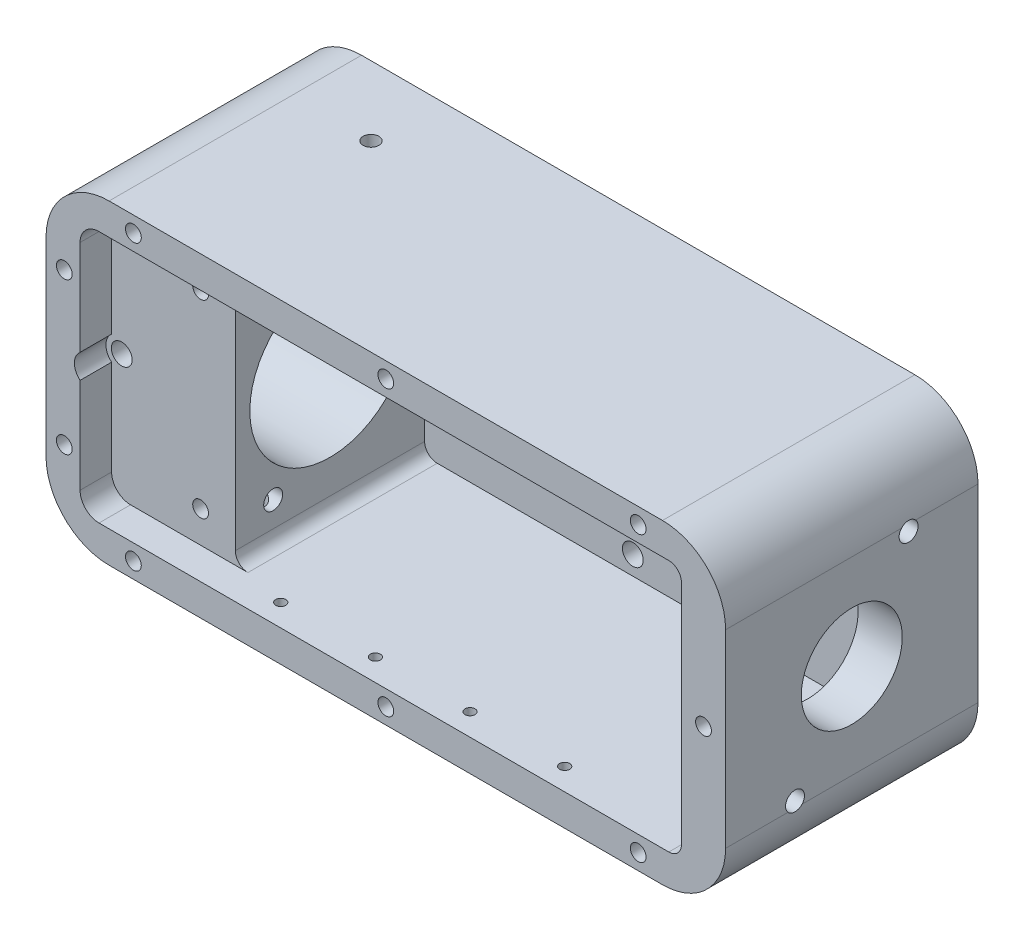
from build123d import *

# Parameters (mm, degrees)
SKETCH1_W                  = 107.7
SKETCH1_H                  = 50
BOSS_EXTRUDE1_DEPTH        = 40
SKETCH2_W                  = 75.7
SKETCH2_H                  = 40
CUT_EXTRUDE1_DEPTH         = 35
CUT_EXTRUDE2_REACH         = 125.791
SKETCH4_W                  = 19.6
SKETCH4_H                  = 40
SKETCH5_W                  = 45
SKETCH5_H                  = 10.3
CUT_EXTRUDE3_DEPTH         = 126.296807621
M4X0_7_TAPPED_HOLE1_D      = 3.3
F_3_0MM_DOWEL_HOLE1_D      = 3
F_3_0MM_DOWEL_HOLE1_DEPTH  = 7
F_3_0MM_DOWEL_HOLE2_D      = 3
F_3_0MM_DOWEL_HOLE2_DEPTH  = 7
M3X0_5_TAPPED_HOLE1_D      = 2.5
M3X0_5_TAPPED_HOLE1_DEPTH  = 7.5
M3X0_5_TAPPED_HOLE1_TIP    = 0.751075774
F_3_0MM_DOWEL_HOLE3_D      = 3
HOLE1_D                    = 16
HOLE1_DEPTH                = 7
M3X0_5_TAPPED_HOLE2_D      = 2.5
M3X0_5_TAPPED_HOLE2_DEPTH  = 7.5
M3X0_5_TAPPED_HOLE2_TIP    = 0.751075774
F_3_0MM_DOWEL_HOLE4_D      = 3
M3X0_5_TAPPED_HOLE3_D      = 2.5
M3X0_5_TAPPED_HOLE3_DEPTH  = 7.5
M3X0_5_TAPPED_HOLE3_TIP    = 0.751075774
M3X0_5_TAPPED_HOLE4_REACH  = 127.297
M3X0_5_TAPPED_HOLE4_BORE_R = 1.25
F_1_1_DIAMETER_HOLE1_D     = 25.4
F_1_1_DIAMETER_HOLE1_DEPTH = 25
M4X0_7_TAPPED_HOLE2_D      = 3.3
M4X0_7_TAPPED_HOLE2_DEPTH  = 7.407641206
M3X0_5_TAPPED_HOLE5_D      = 2.5
M3X0_5_TAPPED_HOLE5_DEPTH  = 5
M3X0_5_TAPPED_HOLE5_TIP    = 0.751075774
FILLET1_R                  = 2
FILLET2_R                  = 3
FILLET3_R                  = 10
SKETCH32_R                 = 2.5
CUT_EXTRUDE4_DEPTH         = 5
M2X0_4_TAPPED_HOLE1_D      = 1.6
M2X0_4_TAPPED_HOLE1_DEPTH  = 5.2
M2X0_4_TAPPED_HOLE1_TIP    = 0.480688495


with BuildPart() as part:
    # Sketch1 → Boss-Extrude1 (new body)
    with BuildSketch(Plane.XY.offset(40)):
        with Locations((53.85, -25)):
            Rectangle(SKETCH1_W, SKETCH1_H)
    extrude(amount=-BOSS_EXTRUDE1_DEPTH)

    # Sketch2 → Cut-Extrude1 (cut)
    with BuildSketch(Plane.XY.offset(40)):
        with Locations((62.85, -25)):
            Rectangle(SKETCH2_W, SKETCH2_H)
    extrude(amount=-CUT_EXTRUDE1_DEPTH, mode=Mode.SUBTRACT)

    # Sketch4 → Cut-Extrude2 (cut, up to next)
    with BuildSketch(Plane(origin=(0, 0, 35), x_dir=(-1, 0, 0), z_dir=(0, 0, -1)), mode=Mode.PRIVATE) as cut_extrude2_sk1:
        with Locations((-15.2, -25)):
            Rectangle(SKETCH4_W, SKETCH4_H)
    cut_extrude2_tool1 = extrude(cut_extrude2_sk1.sketch, amount=-CUT_EXTRUDE2_REACH, mode=Mode.PRIVATE) & part.part
    add(cut_extrude2_tool1.solids().sort_by_distance((15.2, -25, 35))[0], mode=Mode.SUBTRACT)

    # Sketch5 → Cut-Extrude3 (cut, through all)
    with BuildSketch(Plane(origin=(0, 0, 0), x_dir=(-1, 0, 0), z_dir=(0, 0, -1))):
        with Locations((-77.2, -25)):
            Rectangle(SKETCH5_W, SKETCH5_H)
    extrude(amount=-CUT_EXTRUDE3_DEPTH, mode=Mode.SUBTRACT)

    # M4x0.7 Tapped Hole1 (through all)
    with Locations(Plane(origin=(0, 0, 0), x_dir=(-1, 0, 0), z_dir=(0, 0, -1))):
        with Locations((-58, -42), (-78, -42), (-98, -42), (-98, -8), (-58, -8), (-78, -8)):
            Hole(M4X0_7_TAPPED_HOLE1_D / 2)

    # Ø3.0mm Dowel Hole1
    with Locations(Plane.ZY.offset(-100.7)):
        with Locations((11, -11)):
            Hole(F_3_0MM_DOWEL_HOLE1_D / 2, depth=F_3_0MM_DOWEL_HOLE1_DEPTH)

    # Ø3.0mm Dowel Hole2
    with Locations(Plane(origin=(107.7, 0, 0), x_dir=(0, 0, -1), z_dir=(1, 0, 0))):
        with Locations((-29, -39)):
            Hole(F_3_0MM_DOWEL_HOLE2_D / 2, depth=F_3_0MM_DOWEL_HOLE2_DEPTH)

    # M3x0.5 Tapped Hole1
    with Locations(Plane(origin=(0, 0, 0), x_dir=(1, 0, 0), z_dir=(0, 1, 0))):
        with Locations((22.5, -11)):
            Hole(M3X0_5_TAPPED_HOLE1_D / 2, depth=M3X0_5_TAPPED_HOLE1_DEPTH)
            with Locations((0, 0, -(M3X0_5_TAPPED_HOLE1_DEPTH + M3X0_5_TAPPED_HOLE1_TIP / 2))):  # 118° drill point
                Cone(0, M3X0_5_TAPPED_HOLE1_D / 2, M3X0_5_TAPPED_HOLE1_TIP, mode=Mode.SUBTRACT)

    # Ø3.0mm Dowel Hole3 (through all)
    with Locations(Plane(origin=(25, 0, 0), x_dir=(0, 0, -1), z_dir=(1, 0, 0))):
        with Locations((-11, -11)):
            Hole(F_3_0MM_DOWEL_HOLE3_D / 2)

    # Hole1
    with Locations(Plane.ZY.offset(-100.7)):
        with Locations((20, -25)):
            Hole(HOLE1_D / 2, depth=HOLE1_DEPTH)

    # M3x0.5 Tapped Hole2
    with Locations(Plane.XY.offset(40)):
        with Locations((104.2, -25)):
            Hole(M3X0_5_TAPPED_HOLE2_D / 2, depth=M3X0_5_TAPPED_HOLE2_DEPTH)
            with Locations((0, 0, -(M3X0_5_TAPPED_HOLE2_DEPTH + M3X0_5_TAPPED_HOLE2_TIP / 2))):  # 118° drill point
                Cone(0, M3X0_5_TAPPED_HOLE2_D / 2, M3X0_5_TAPPED_HOLE2_TIP, mode=Mode.SUBTRACT)

    # Ø3.0mm Dowel Hole4 (through all)
    with Locations(Plane.ZY):
        with Locations((29, -39)):
            Hole(F_3_0MM_DOWEL_HOLE4_D / 2)

    # M3x0.5 Tapped Hole3
    with Locations(Plane.XY.offset(40)):
        with Locations((2.9, -37), (93.85, -2.5), (53.85, -2.5), (13.85, -2.5), (2.9, -13), (13.85, -47.5), (53.85, -47.5), (93.85, -47.5)):
            Hole(M3X0_5_TAPPED_HOLE3_D / 2, depth=M3X0_5_TAPPED_HOLE3_DEPTH)
            with Locations((0, 0, -(M3X0_5_TAPPED_HOLE3_DEPTH + M3X0_5_TAPPED_HOLE3_TIP / 2))):  # 118° drill point
                Cone(0, M3X0_5_TAPPED_HOLE3_D / 2, M3X0_5_TAPPED_HOLE3_TIP, mode=Mode.SUBTRACT)

    # M3x0.5 Tapped Hole4 bore → M3x0.5 Tapped Hole4 (cut, up to next)
    with BuildSketch(Plane(origin=(0, -50, 0), x_dir=(-1, 0, 0), z_dir=(0, -1, 0)), mode=Mode.PRIVATE) as m3x0_5_tapped_hole4_sk1:
        with Locations((-22.5, -29)):
            Circle(M3X0_5_TAPPED_HOLE4_BORE_R)
    m3x0_5_tapped_hole4_tool1 = extrude(m3x0_5_tapped_hole4_sk1.sketch, amount=-M3X0_5_TAPPED_HOLE4_REACH, mode=Mode.PRIVATE) & part.part
    add(m3x0_5_tapped_hole4_tool1.solids().sort_by_distance((22.5, -50, 29))[0], mode=Mode.SUBTRACT)

    # 1 (1) Diameter Hole1
    with Locations(Plane.ZY):
        with Locations((20, -25)):
            Hole(F_1_1_DIAMETER_HOLE1_D / 2, depth=F_1_1_DIAMETER_HOLE1_DEPTH)

    # M4x0.7 Tapped Hole2
    with Locations(Plane(origin=(0, 0, 32.592358794), x_dir=(-1, 0, 0), z_dir=(0, 0, -1))):
        with Locations((-7, -25)):
            Hole(M4X0_7_TAPPED_HOLE2_D / 2, depth=M4X0_7_TAPPED_HOLE2_DEPTH)

    # M3x0.5 Tapped Hole5
    with Locations(Plane.XY.offset(35)):
        with Locations((19.5, -10), (19.5, -40)):
            Hole(M3X0_5_TAPPED_HOLE5_D / 2, depth=M3X0_5_TAPPED_HOLE5_DEPTH)
            with Locations((0, 0, -(M3X0_5_TAPPED_HOLE5_DEPTH + M3X0_5_TAPPED_HOLE5_TIP / 2))):  # 118° drill point
                Cone(0, M3X0_5_TAPPED_HOLE5_D / 2, M3X0_5_TAPPED_HOLE5_TIP, mode=Mode.SUBTRACT)

    # Fillet1
    fillet1_edges = [part.edges().sort_by_distance(p)[0] for p in [
        (100.7, -45, 22.5),
        (25, -45, 20),
        (25, -5, 20),
        (100.7, -5, 22.5),
        (99.7, -30.15, 2.5),
        (99.7, -19.85, 2.5),
        (54.7, -19.85, 2.5),
        (54.7, -30.15, 2.5),
    ]]
    fillet(fillet1_edges, radius=FILLET1_R)

    # Fillet2
    fillet2_edges = [part.edges().sort_by_distance(p)[0] for p in [
        (5.4, -45, 37.5),
        (5.4, -5, 37.5),
    ]]
    fillet(fillet2_edges, radius=FILLET2_R)

    # Fillet3
    # the kernel refuses this fillet: 10 mm, written as the material it takes off along each edge
    with BuildSketch(Plane(origin=(0, 0, 65), x_dir=(0, -1, 0), z_dir=(0, 0, -1)), Plane(origin=(0, -50, 65), x_dir=(1, 0, 0), z_dir=(0, 0, -1))) as fillet3_piece_1:
        with BuildLine():
            CenterArc((FILLET3_R, -FILLET3_R), FILLET3_R, 90, 90)
            Line((0, -FILLET3_R), (0, 0))
            Line((0, 0), (FILLET3_R, 0))
        make_face()
    extrude(amount=90, mode=Mode.SUBTRACT)
    with BuildSketch(Plane(origin=(107.7, 0, 65), x_dir=(0, -1, 0), z_dir=(0, 0, -1)), Plane(origin=(107.7, -50, 65), x_dir=(-1, 0, 0), z_dir=(0, 0, -1))) as fillet3_piece_2:
        with BuildLine():
            CenterArc((FILLET3_R, FILLET3_R), FILLET3_R, 180, 90)
            Line((0, FILLET3_R), (0, 0))
            Line((0, 0), (FILLET3_R, 0))
        make_face()
    extrude(amount=90, mode=Mode.SUBTRACT)

    # Sketch32 → Cut-Extrude4 (cut)
    with BuildSketch(Plane.XY.offset(40)):
        with Locations((7, -25)):
            Circle(SKETCH32_R)
    extrude(amount=-CUT_EXTRUDE4_DEPTH, mode=Mode.SUBTRACT)

    # M2x0.4 Tapped Hole1
    with Locations(Plane(origin=(0, -45, 0), x_dir=(1, 0, 0), z_dir=(0, 1, 0))):
        with Locations((33.7, -36.5), (48.7, -36.5), (63.7, -36.5), (78.7, -36.5)):
            Hole(M2X0_4_TAPPED_HOLE1_D / 2, depth=M2X0_4_TAPPED_HOLE1_DEPTH)
            with Locations((0, 0, -(M2X0_4_TAPPED_HOLE1_DEPTH + M2X0_4_TAPPED_HOLE1_TIP / 2))):  # 118° drill point
                Cone(0, M2X0_4_TAPPED_HOLE1_D / 2, M2X0_4_TAPPED_HOLE1_TIP, mode=Mode.SUBTRACT)


solid = part.part
